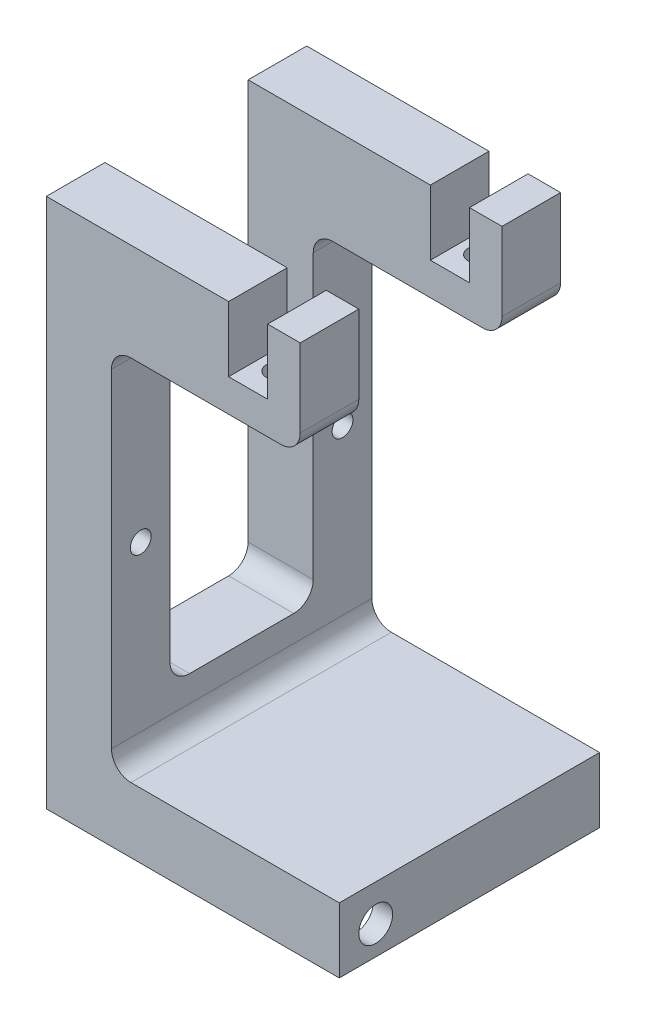
from build123d import *

# Parameters (mm, degrees)
BOSS_EXTRUDE1_DEPTH = 40
SKETCH2_W           = 22
SKETCH2_H           = 64.5
CUT_EXTRUDE1_DEPTH  = 102.327439522
CUT_EXTRUDE2_REACH  = 95.473
SKETCH4_R           = 1.7
SKETCH7_R           = 2.6
CUT_EXTRUDE3_DEPTH  = 10
FILLET1_R           = 3
FILLET2_R           = 3
SKETCH8_W           = 39
SKETCH8_H           = 34
CUT_EXTRUDE4_DEPTH  = 7
CUT_EXTRUDE5_REACH  = 99.3
SKETCH9_R           = 1.6


with BuildPart() as part:
    # Sketch1 → Boss-Extrude1 (new body)
    with BuildSketch(Plane.XY):
        Polygon((10, 10), (45, 10), (45, 0), (0, 0), (0, 81.5), (28, 81.5), (28, 71.5), (34, 71.5), (34, 81.5), (39, 81.5), (39, 66.5), (10, 66.5), align=None)
    extrude(amount=BOSS_EXTRUDE1_DEPTH)

    # Sketch2 → Cut-Extrude1 (cut, through all)
    with BuildSketch(Plane.ZY):
        with Locations((20, 49.25)):
            Rectangle(SKETCH2_W, SKETCH2_H)
    extrude(amount=-CUT_EXTRUDE1_DEPTH, mode=Mode.SUBTRACT)

    # Sketch4 → Cut-Extrude2 (cut, up to next)
    with BuildSketch(Plane(origin=(0, 71.5, 0), x_dir=(1, 0, 0), z_dir=(0, 1, 0)), mode=Mode.PRIVATE) as cut_extrude2_sk1:
        with Locations((31, -35.5)):
            Circle(SKETCH4_R)
    cut_extrude2_tool1 = extrude(cut_extrude2_sk1.sketch, amount=-CUT_EXTRUDE2_REACH, mode=Mode.PRIVATE) & part.part
    # Sketch4 → Cut-Extrude2 (cut, up to next)
    with BuildSketch(Plane(origin=(0, 71.5, 0), x_dir=(1, 0, 0), z_dir=(0, 1, 0)), mode=Mode.PRIVATE) as cut_extrude2_sk2:
        with Locations((31, -4.5)):
            Circle(SKETCH4_R)
    cut_extrude2_tool2 = extrude(cut_extrude2_sk2.sketch, amount=-CUT_EXTRUDE2_REACH, mode=Mode.PRIVATE) & part.part
    add(cut_extrude2_tool1.solids().sort_by_distance((31, 71.5, 35.5))[0], mode=Mode.SUBTRACT)
    add(cut_extrude2_tool2.solids().sort_by_distance((31, 71.5, 4.5))[0], mode=Mode.SUBTRACT)

    # Sketch7 → Cut-Extrude3 (cut)
    with BuildSketch(Plane(origin=(45, 0, 0), x_dir=(0, 0, -1), z_dir=(1, 0, 0))):
        with Locations((-34.4, 4.4)):
            Circle(SKETCH7_R)
    extrude(amount=-CUT_EXTRUDE3_DEPTH, mode=Mode.SUBTRACT)

    # Fillet1
    fillet1_edges = [part.edges().sort_by_distance(p)[0] for p in [
        (10, 10, 20),
        (5, 17, 31),
        (5, 17, 9),
    ]]
    fillet(fillet1_edges, radius=FILLET1_R)

    # Fillet2
    fillet2_edges = [part.edges().sort_by_distance(p)[0] for p in [
        (39, 66.5, 4.5),
        (39, 66.5, 35.5),
        (10, 66.5, 35.5),
        (10, 66.5, 4.5),
    ]]
    fillet(fillet2_edges, radius=FILLET2_R)

    # Sketch8 → Cut-Extrude4 (cut)
    with BuildSketch(Plane.XZ):
        with Locations((22.5, 20)):
            Rectangle(SKETCH8_W, SKETCH8_H)
    extrude(amount=-CUT_EXTRUDE4_DEPTH, mode=Mode.SUBTRACT)

    # Sketch9 → Cut-Extrude5 (cut, up to next)
    with BuildSketch(Plane(origin=(10, 0, 0), x_dir=(0, 0, -1), z_dir=(1, 0, 0)), mode=Mode.PRIVATE) as cut_extrude5_sk1:
        with Locations((-4.5, 38.25)):
            Circle(SKETCH9_R)
    cut_extrude5_tool1 = extrude(cut_extrude5_sk1.sketch, amount=-CUT_EXTRUDE5_REACH, mode=Mode.PRIVATE) & part.part
    # Sketch9 → Cut-Extrude5 (cut, up to next)
    with BuildSketch(Plane(origin=(10, 0, 0), x_dir=(0, 0, -1), z_dir=(1, 0, 0)), mode=Mode.PRIVATE) as cut_extrude5_sk2:
        with Locations((-35.5, 38.25)):
            Circle(SKETCH9_R)
    cut_extrude5_tool2 = extrude(cut_extrude5_sk2.sketch, amount=-CUT_EXTRUDE5_REACH, mode=Mode.PRIVATE) & part.part
    add(cut_extrude5_tool1.solids().sort_by_distance((10, 38.25, 4.5))[0], mode=Mode.SUBTRACT)
    add(cut_extrude5_tool2.solids().sort_by_distance((10, 38.25, 35.5))[0], mode=Mode.SUBTRACT)


solid = part.part
